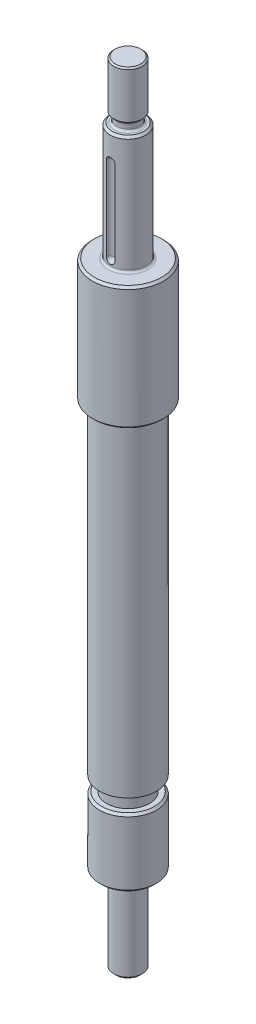
from build123d import *

# Parameters (mm, degrees)
SKETCH2_R          = 0.6
CUT_EXTRUDE1_DEPTH = 13
FILLET1_R          = 0.6
CHAMFER1_SIZE      = 0.3
CHAMFER2_SIZE      = 0.3
CHAMFER3_SIZE      = 0.3
CHAMFER4_SIZE      = 0.3
CHAMFER5_SIZE      = 0.2
FILLET2_R          = 0.3


# Some blends are built 0.0001 mm under size
with BuildPart() as part:
    # Sketch1 → Revolve1 (revolve)
    with BuildSketch(Plane.XY, mode=Mode.PRIVATE) as revolve1_sk:
        Polygon((0, 0), (2, 0), (2, 12), (4, 12), (4, 21.5), (3, 21.5), (3, 23.5), (4, 23.5), (4, 69), (5, 69), (5, 86.3), (2.5, 86.3), (2.5, 102.8), (1.6, 102.8), (1.6, 104), (2, 104), (2, 110.8), (0, 110.8), align=None)
    revolve(revolve1_sk.sketch.rotate(Axis((0, 0, 0), (0, 1, 0)), 90), axis=Axis((0, 0, 0), (0, 1, 0)))

    # Sketch2 → Cut-Extrude1 (cut)
    with BuildSketch(Plane(origin=(0, 86.8, 0), x_dir=(1, 0, 0), z_dir=(0, 1, 0))):
        with Locations((0, 2.5)):
            Circle(SKETCH2_R)
        with Locations((0, -2.5)):
            Circle(SKETCH2_R)
    extrude(amount=CUT_EXTRUDE1_DEPTH, mode=Mode.SUBTRACT)

    # Fillet1
    fillet1_edges = [part.edges().sort_by_distance(p)[0] for p in [
        (0, 99.8, -1.9),
        (0, 86.8, -1.9),
        (0, 86.8, 1.9),
        (0, 99.8, 1.9),
    ]]
    fillet(fillet1_edges, radius=FILLET1_R - 0.0001)  # a hair under: the kernel refuses the full size

    # Chamfer1
    chamfer1_edges = [part.edges().sort_by_distance(p)[0] for p in [
        (0, 86.3, 5),
        (0, 69, 5),
    ]]
    chamfer(chamfer1_edges, length=CHAMFER1_SIZE)

    # Chamfer2
    chamfer2_edges = [part.edges().sort_by_distance(p)[0] for p in [
        (0, 21.5, 4),
        (0, 12, 4),
    ]]
    chamfer(chamfer2_edges, length=CHAMFER2_SIZE)

    # Chamfer3
    chamfer3_edges = [part.edges().sort_by_distance(p)[0] for p in [
        (0, 0, 2),
    ]]
    chamfer(chamfer3_edges, length=CHAMFER3_SIZE)

    # Chamfer4
    chamfer4_edges = [part.edges().sort_by_distance(p)[0] for p in [
        (0, 102.8, 2.5),
    ]]
    chamfer(chamfer4_edges, length=CHAMFER4_SIZE)

    # Chamfer5
    chamfer5_edges = [part.edges().sort_by_distance(p)[0] for p in [
        (0, 110.8, 2),
        (0, 104, 2),
    ]]
    chamfer(chamfer5_edges, length=CHAMFER5_SIZE)

    # Fillet2
    # the kernel refuses this fillet: 0.3 mm, written as the material it adds along each edge
    with BuildSketch(Plane(origin=(0, 104, 0), x_dir=(0, 0, -1), z_dir=(1, 0, 0))) as fillet2_piece_1:
        with BuildLine():
            CenterArc((1.9, -0.282842712), FILLET2_R, 109.471220634, 70.528779366)
            Line((1.6, -0.282842712), (1.594, -0.282842712))
            Line((1.594, -0.282842712), (1.594, 0))
            Line((1.594, 0), (1.6, 0.006))
            ThreePointArc((1.6, 0.006), (1.7, 0.006), (1.798, 0.005656854))
            Line((1.798, 0.005656854), (1.8, 0))
        make_face()
    revolve(axis=Axis((0, 104, 0), (0, 1, 0)))
    with BuildSketch(Plane(origin=(0, 102.8, 0), x_dir=(0, 0, -1), z_dir=(1, 0, 0))) as fillet2_piece_2:
        with BuildLine():
            CenterArc((1.6 + FILLET2_R, FILLET2_R), FILLET2_R, 180, 90)
            Line((1.6 + FILLET2_R, 0), (1.6 + FILLET2_R, -FILLET2_R * 0.02))
            Line((1.6 + FILLET2_R, -FILLET2_R * 0.02), (1.6 - FILLET2_R * 0.02, -FILLET2_R * 0.02))
            Line((1.6 - FILLET2_R * 0.02, -FILLET2_R * 0.02), (1.6 - FILLET2_R * 0.02, FILLET2_R))
            Line((1.6 - FILLET2_R * 0.02, FILLET2_R), (1.6, FILLET2_R))
        make_face()
    revolve(axis=Axis((0, 102.8, 0), (0, 1, 0)))
    with BuildSketch(Plane(origin=(0, 86.3, 0), x_dir=(0, 0, -1), z_dir=(1, 0, 0))) as fillet2_piece_3:
        with BuildLine():
            CenterArc((2.5 + FILLET2_R, FILLET2_R), FILLET2_R, 180, 90)
            Line((2.5 + FILLET2_R, 0), (2.5 + FILLET2_R, -FILLET2_R * 0.02))
            Line((2.5 + FILLET2_R, -FILLET2_R * 0.02), (2.5 - FILLET2_R * 0.02, -FILLET2_R * 0.02))
            Line((2.5 - FILLET2_R * 0.02, -FILLET2_R * 0.02), (2.5 - FILLET2_R * 0.02, FILLET2_R))
            Line((2.5 - FILLET2_R * 0.02, FILLET2_R), (2.5, FILLET2_R))
        make_face()
    revolve(axis=Axis((0, 86.3, 0), (0, 1, 0)))
    with BuildSketch(Plane(origin=(0, 69, 0), x_dir=(0, 0, -1), z_dir=(1, 0, 0))) as fillet2_piece_4:
        with BuildLine():
            CenterArc((4 + FILLET2_R, -FILLET2_R), FILLET2_R, 90, 90)
            Line((4, -FILLET2_R), (4 - FILLET2_R * 0.02, -FILLET2_R))
            Line((4 - FILLET2_R * 0.02, -FILLET2_R), (4 - FILLET2_R * 0.02, FILLET2_R * 0.02))
            Line((4 - FILLET2_R * 0.02, FILLET2_R * 0.02), (4 + FILLET2_R, FILLET2_R * 0.02))
            Line((4 + FILLET2_R, FILLET2_R * 0.02), (4 + FILLET2_R, 0))
        make_face()
    revolve(axis=Axis((0, 69, 0), (0, 1, 0)))
    with BuildSketch(Plane(origin=(0, 23.5, 0), x_dir=(0, 0, -1), z_dir=(1, 0, 0))) as fillet2_piece_5:
        with BuildLine():
            CenterArc((3 + FILLET2_R, -FILLET2_R), FILLET2_R, 90, 90)
            Line((3, -FILLET2_R), (3 - FILLET2_R * 0.02, -FILLET2_R))
            Line((3 - FILLET2_R * 0.02, -FILLET2_R), (3 - FILLET2_R * 0.02, FILLET2_R * 0.02))
            Line((3 - FILLET2_R * 0.02, FILLET2_R * 0.02), (3 + FILLET2_R, FILLET2_R * 0.02))
            Line((3 + FILLET2_R, FILLET2_R * 0.02), (3 + FILLET2_R, 0))
        make_face()
    revolve(axis=Axis((0, 23.5, 0), (0, 1, 0)))
    with BuildSketch(Plane(origin=(0, 12, 0), x_dir=(0, 0, -1), z_dir=(1, 0, 0))) as fillet2_piece_6:
        with BuildLine():
            CenterArc((2 + FILLET2_R, -FILLET2_R), FILLET2_R, 90, 90)
            Line((2, -FILLET2_R), (2 - FILLET2_R * 0.02, -FILLET2_R))
            Line((2 - FILLET2_R * 0.02, -FILLET2_R), (2 - FILLET2_R * 0.02, FILLET2_R * 0.02))
            Line((2 - FILLET2_R * 0.02, FILLET2_R * 0.02), (2 + FILLET2_R, FILLET2_R * 0.02))
            Line((2 + FILLET2_R, FILLET2_R * 0.02), (2 + FILLET2_R, 0))
        make_face()
    revolve(axis=Axis((0, 12, 0), (0, 1, 0)))


solid = part.part
